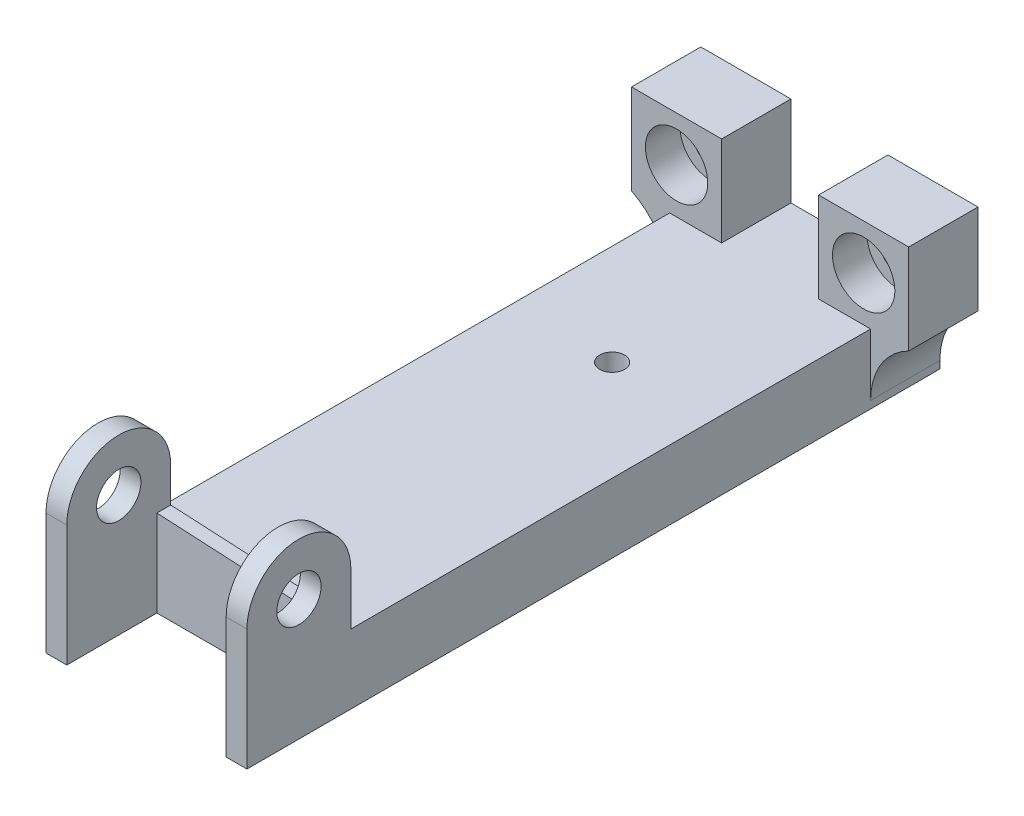
from build123d import *

# Parameters (mm, degrees)
SKETCH_1_W           = 13
SKETCH_1_H           = 13
SKETCH_1_R           = 2.65
EXTRUDE_1_DEPTH      = 10
EXTRUDE_1_2_DEPTH    = 10
SKETCH_2_R           = 4.5
CUT_EXTRUDE_2_DEPTH  = 5
EXTRUDE_2_DEPTH      = 14.5
EXTRUDE_2_DEPTH_BACK = 14.5
SKETCH_4_W           = 85
SKETCH_4_H           = 10
FILLET_6_R           = 10
SKETCH_9_R           = 3.2
EXTRUDE_3_DEPTH      = 29
CUT_EXTRUDE_6_DEPTH  = 13
CUT_EXTRUDE_7_DEPTH  = 5
SKETCH_12_R          = 1.8
CUT_EXTRUDE_8_DEPTH  = 12


with BuildPart() as part:
    # 草图1 → 凸台-拉伸1 (new body)
    with BuildSketch(Plane.XY):
        with Locations((-7.792845361, -5.303981357)):
            Rectangle(SKETCH_1_W, SKETCH_1_H)
        with Locations((-7.792845361, -5.303981357)):
            Circle(SKETCH_1_R, mode=Mode.SUBTRACT)
    extrude(amount=EXTRUDE_1_DEPTH)


with BuildPart() as body_2:
    # 草图1 → Extrude 1 2 (new body)
    with BuildSketch(Plane.XY):
        Polygon((12.707154639, 1.196018643), (25.707154639, 1.196018643), (25.707154639, -5.303981357), (25.707154639, -11.803981357), (12.707154639, -11.803981357), align=None)
        with Locations((19.207154639, -5.303981357)):
            Circle(SKETCH_1_R, mode=Mode.SUBTRACT)
    extrude(amount=EXTRUDE_1_2_DEPTH)


with BuildPart() as cut_extrude_2_tool:
    # 草图2 → 切除-拉伸2 (new body)
    with BuildSketch(Plane.XY.offset(10)):
        with Locations((-7.792845361, -5.303981357)):
            Circle(SKETCH_2_R)
        with Locations((19.207154639, -5.303981357)):
            Circle(SKETCH_2_R)
    extrude(amount=-CUT_EXTRUDE_2_DEPTH)


with BuildPart() as part_1:
    add(part.part)

    # 切除-拉伸2: cut by cut_extrude_2_tool
    add(cut_extrude_2_tool.part, mode=Mode.SUBTRACT)



with BuildPart() as body_2_1:
    add(body_2.part)

    # 切除-拉伸2: cut by cut_extrude_2_tool
    add(cut_extrude_2_tool.part, mode=Mode.SUBTRACT)


with BuildPart() as part_2:
    add(part_1.part)

    add(body_2_1.part)  # 凸台-拉伸2 merges body 2
    # 草图4 → 凸台-拉伸2 (add, two sides: drawn at the far end of the back side and taken through both)
    with BuildSketch(Plane.ZY.offset(-5.707154639).offset(-EXTRUDE_2_DEPTH_BACK)):
        with Locations((42.5, -16.803981357)):
            Rectangle(SKETCH_4_W, SKETCH_4_H)
    extrude(amount=EXTRUDE_2_DEPTH + EXTRUDE_2_DEPTH_BACK)

    # 圆角6
    # the kernel refuses this fillet: 10 mm, written as the material it adds along each edge
    with BuildSketch(Plane(origin=(20.207154639, -11.803981357, 0), x_dir=(0, -1, 0), z_dir=(0, 0, 1))) as fillet_6_piece_1:
        with BuildLine():
            CenterArc((8.93028555, 10), FILLET_6_R, 206.74368395, 63.25631605)
            Line((0, 5.5), (0, 0))
            Line((0, 0), (8.93028555, 0))
        make_face()
    extrude(amount=10)
    with BuildSketch(Plane(origin=(-8.792845361, -11.803981357, 0), x_dir=(-1, 0, 0), z_dir=(0, 0, 1))) as fillet_6_piece_2:
        with BuildLine():
            CenterArc((10, 8.93028555), FILLET_6_R, 180, 63.25631605)
            Line((0, 8.93028555), (0, 0))
            Line((0, 0), (5.5, 0))
        make_face()
    extrude(amount=10)

    # 草图9 → 凸台-拉伸3 (add)
    with BuildSketch(Plane.ZY.offset(8.792845361)):
        with BuildLine():
            Line((85, -21.803981357), (100, -21.803981357))
            Line((100, -21.803981357), (100, -4.303981357))
            ThreePointArc((100, -4.303981357), (92.5, 3.196018643), (85, -4.303981357))
            Line((85, -4.303981357), (85, -21.803981357))
        make_face()
        with Locations((92.5, -4.303981357)):
            Circle(SKETCH_9_R, mode=Mode.SUBTRACT)
    extrude(amount=-EXTRUDE_3_DEPTH)

    # 草图10 → 切除-拉伸6 (cut)
    with BuildSketch(Plane.XY.offset(100)):
        Polygon((17.207154639, 3.196018643), (17.207154639, -19.803981357), (17.207154639, -21.803981357), (-5.792845361, -21.803981357), (-5.792845361, -19.803981357), (-5.792845361, 3.196018643), align=None)
    extrude(amount=-CUT_EXTRUDE_6_DEPTH, mode=Mode.SUBTRACT)

    # 草图11 → 切除-拉伸7 (cut)
    with BuildSketch(Plane.XY.offset(87)):
        Polygon((-5.792845361, 3.128632746), (-5.792845361, -9.303981357), (17.207154639, -10.5044716), (17.207154639, 3.128632746), align=None)
    extrude(amount=-CUT_EXTRUDE_7_DEPTH, mode=Mode.SUBTRACT)

    # 草图12 → 切除-拉伸8 (cut)
    with BuildSketch(Plane.XZ.offset(21.803981357)):
        with Locations(Location((5.707154639, 32.798781039, 0), (0, 0, 270))):
            Circle(SKETCH_12_R)
        with Locations((5.707154639, 95.098664418)):
            Circle(SKETCH_12_R)
    extrude(amount=-CUT_EXTRUDE_8_DEPTH, mode=Mode.SUBTRACT)


solid = part_2.part
